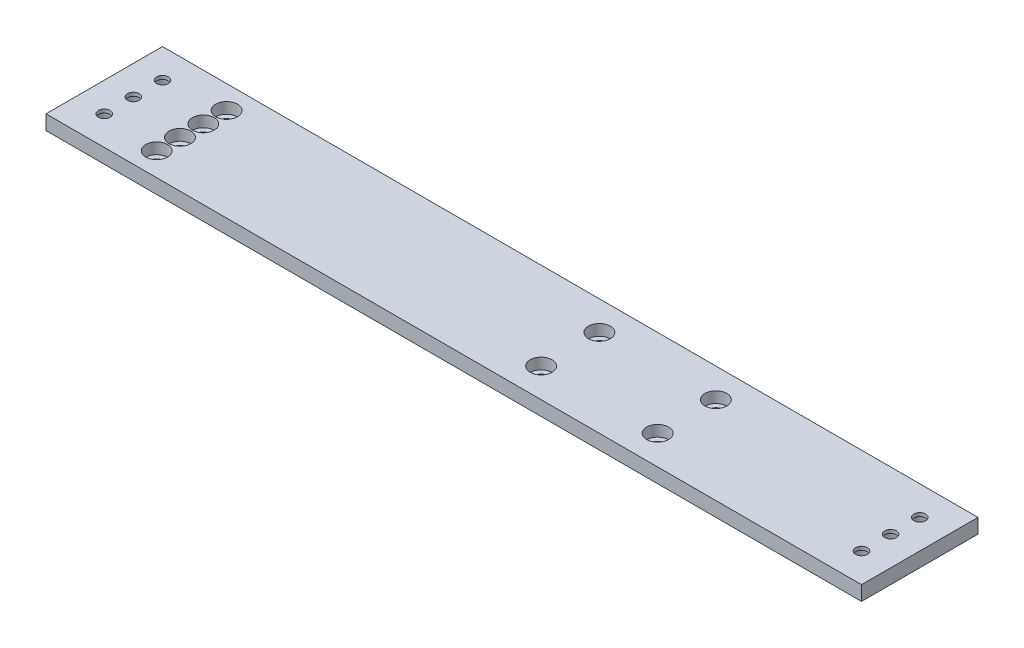
from build123d import *

# Parameters (mm, degrees)
SKETCH1_W                                       = 355.6
SKETCH1_H                                       = 50.8
BOSS_EXTRUDE1_DEPTH                             = 6.35
CBORE_FOR_10_SOCKET_HEAD_CAP_SCREW1_D           = 5.1054
CBORE_FOR_10_SOCKET_HEAD_CAP_SCREW1_CBORE_D     = 9.525
CBORE_FOR_10_SOCKET_HEAD_CAP_SCREW1_CBORE_DEPTH = 4.826
CBORE_FOR_10_SOCKET_HEAD_CAP_SCREW2_D           = 5.1054
CBORE_FOR_10_SOCKET_HEAD_CAP_SCREW2_CBORE_D     = 9.525
CBORE_FOR_10_SOCKET_HEAD_CAP_SCREW2_CBORE_DEPTH = 4.826


with BuildPart() as part:
    # Sketch1 → Boss-Extrude1 (new body)
    with BuildSketch(Plane(origin=(0, 0, 0), x_dir=(1, 0, 0), z_dir=(0, 1, 0))):
        Rectangle(SKETCH1_W, SKETCH1_H)
    extrude(amount=BOSS_EXTRUDE1_DEPTH)

    # CBORE for #10 Socket Head Cap Screw1 (through all)
    with Locations(Plane(origin=(0, 6.35, 0), x_dir=(1, 0, 0), z_dir=(0, 1, 0))):
        with Locations((-139.7, -5.08), (25.4, 12.7), (76.2, 12.7), (25.4, -12.7), (76.2, -12.7), (-139.7, 15.24), (-139.7, 5.08), (-139.7, -15.24)):
            CounterBoreHole(CBORE_FOR_10_SOCKET_HEAD_CAP_SCREW1_D / 2, CBORE_FOR_10_SOCKET_HEAD_CAP_SCREW1_CBORE_D / 2, CBORE_FOR_10_SOCKET_HEAD_CAP_SCREW1_CBORE_DEPTH)

    # CBORE for #10 Socket Head Cap Screw2 (through all)
    with Locations(Plane.XZ):
        with Locations((-165.1, 12.7), (-165.1, 0), (-165.1, -12.7), (165.1, 12.7), (165.1, 0), (165.1, -12.7)):
            CounterBoreHole(CBORE_FOR_10_SOCKET_HEAD_CAP_SCREW2_D / 2, CBORE_FOR_10_SOCKET_HEAD_CAP_SCREW2_CBORE_D / 2, CBORE_FOR_10_SOCKET_HEAD_CAP_SCREW2_CBORE_DEPTH)


solid = part.part
